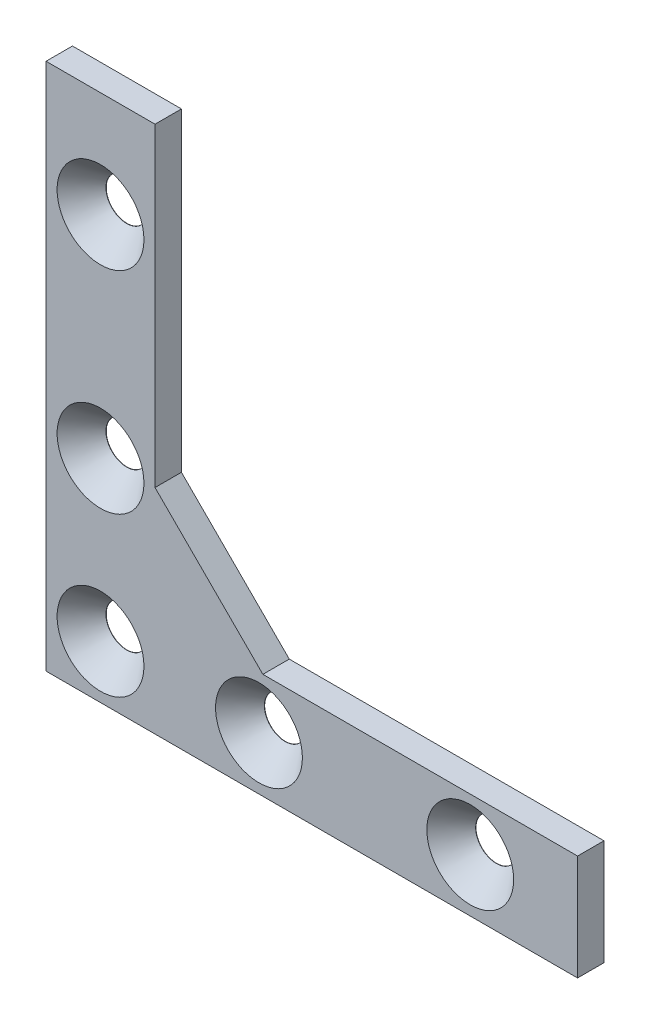
from build123d import *

# Parameters (mm, degrees)
BOSS_EXTRUDE1_DEPTH             = 3.175
F_10_CLEARANCE_HOLE1_AT_2_COUNT = 2
F_10_CLEARANCE_HOLE1_AT_2_PITCH = 19.05
F_10_CLEARANCE_HOLE1_AT_3_COUNT = 2
F_10_CLEARANCE_HOLE1_AT_3_PITCH = 44.411770585
F_10_CLEARANCE_HOLE1_AT_4_COUNT = 2
F_10_CLEARANCE_HOLE1_AT_4_PITCH = 19.05
F_10_CLEARANCE_HOLE1_AT_5_COUNT = 2
F_10_CLEARANCE_HOLE1_AT_5_PITCH = 44.45


with BuildPart() as part:
    # Sketch1 → Boss-Extrude1 (new body)
    with BuildSketch(Plane.XY):
        Polygon((-254.000000508, 0), (-267.103367516, 0), (-267.103367516, 63.5), (-254.000000508, 63.5), (-254.000000508, 25.666043074), (-241.033957434, 12.7), (-203.200000508, 12.7), (-203.200000508, 0), align=None)
    extrude(amount=BOSS_EXTRUDE1_DEPTH)

    # Sketch4 → #10 Clearance Hole1 (revolve, cut)
    with BuildSketch(Plane(origin=(-260.551684012, 6.388229415, 3.175), x_dir=(0, -1, 0), z_dir=(1, 0, 0))):
        Polygon((0, 0), (0, 3.175), (2.4892, 3.175), (2.4892, 3.141080936), (5.2197, 0), align=None)
    f_10_clearance_hole1 = revolve(axis=Axis((-260.551684012, 6.388229415, 9.525), (0, 0, -1)), mode=Mode.SUBTRACT)

    # #10 Clearance Hole1 at 2: #10 Clearance Hole1 ×2
    with Locations(*[(0, i * F_10_CLEARANCE_HOLE1_AT_2_PITCH, 0) for i in range(1, F_10_CLEARANCE_HOLE1_AT_2_COUNT)]):
        add(f_10_clearance_hole1, mode=Mode.SUBTRACT)

    # #10 Clearance Hole1 at 3: #10 Clearance Hole1 ×2
    with Locations(*[(0, i * F_10_CLEARANCE_HOLE1_AT_3_PITCH, 0) for i in range(1, F_10_CLEARANCE_HOLE1_AT_3_COUNT)]):
        add(f_10_clearance_hole1, mode=Mode.SUBTRACT)

    # #10 Clearance Hole1 at 4: #10 Clearance Hole1 ×2
    with Locations(*[(i * F_10_CLEARANCE_HOLE1_AT_4_PITCH, 0, 0) for i in range(1, F_10_CLEARANCE_HOLE1_AT_4_COUNT)]):
        add(f_10_clearance_hole1, mode=Mode.SUBTRACT)

    # #10 Clearance Hole1 at 5: #10 Clearance Hole1 ×2
    with Locations(*[(i * F_10_CLEARANCE_HOLE1_AT_5_PITCH, 0, 0) for i in range(1, F_10_CLEARANCE_HOLE1_AT_5_COUNT)]):
        add(f_10_clearance_hole1, mode=Mode.SUBTRACT)


solid = part.part
